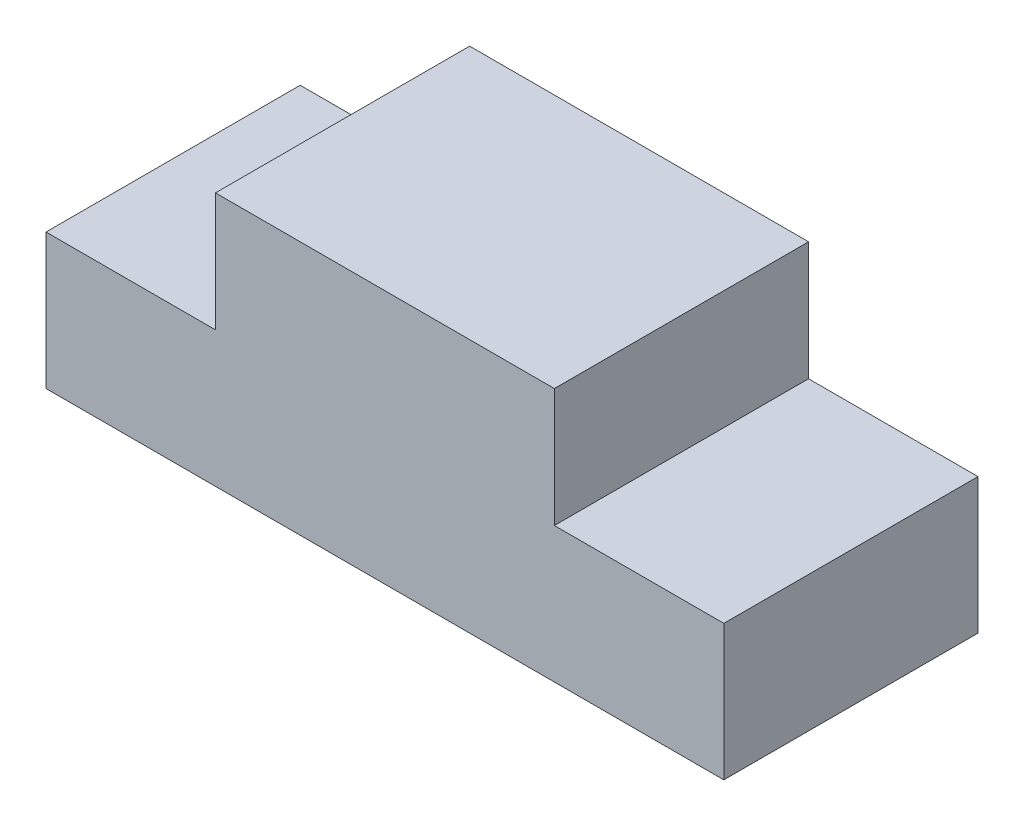
from build123d import *

# Parameters (mm, degrees)
BOSS_EXTRUDE1_DEPTH          = 15
TAP_DRILL_FOR_M10_TAP1_D     = 8.5
TAP_DRILL_FOR_M10_TAP1_DEPTH = 11
TAP_DRILL_FOR_M10_TAP1_TIP   = 2.553657631


with BuildPart() as part:
    # Sketch1 → Boss-Extrude1 (new body)
    with BuildSketch(Plane.XY):
        Polygon((0, 0), (40, 0), (40, 8), (30, 8), (30, 15), (10, 15), (10, 8), (0, 8), align=None)
    extrude(amount=BOSS_EXTRUDE1_DEPTH)

    # Tap Drill for M10 Tap1
    with Locations(Plane(origin=(0, 0, 0), x_dir=(-1, 0, 0), z_dir=(0, 0, -1))):
        with Locations((-20, 9)):
            Hole(TAP_DRILL_FOR_M10_TAP1_D / 2, depth=TAP_DRILL_FOR_M10_TAP1_DEPTH)
            with Locations((0, 0, -(TAP_DRILL_FOR_M10_TAP1_DEPTH + TAP_DRILL_FOR_M10_TAP1_TIP / 2))):  # 118° drill point
                Cone(0, TAP_DRILL_FOR_M10_TAP1_D / 2, TAP_DRILL_FOR_M10_TAP1_TIP, mode=Mode.SUBTRACT)


solid = part.part
